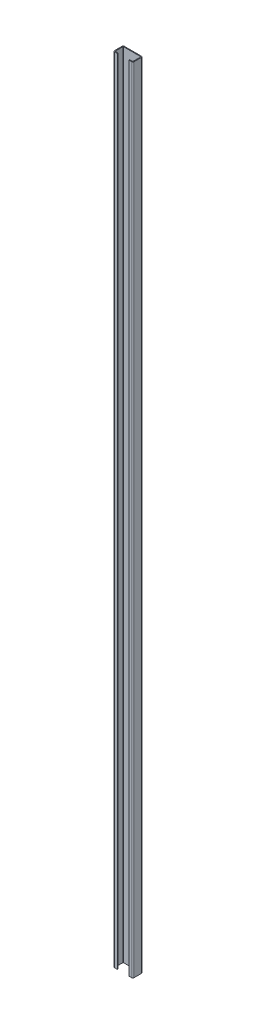
from build123d import *

# Parameters (mm, degrees)
BASEFLANGE_W                   = 50
BASEFLANGE_H                   = 2050
BASE_FLANGE1_DEPTH             = 2
EDGE_FLANGE1_STRIP_W           = 10
EDGE_FLANGE1_STRIP_H           = 2
EDGE_FLANGE1_STRIP_CUT_DEPTH   = 2050
EDGE_FLANGE1_STRIP_2_W         = 10
EDGE_FLANGE1_STRIP_2_H         = 2
EDGE_FLANGE1_STRIP_CUT_2_DEPTH = 2050
EDGE_FLANGE1_DEPTH             = 2050
EDGE_FLANGE1_BEND_DEPTH        = 2050
EDGE_FLANGE2_STRIP_W           = 10
EDGE_FLANGE2_STRIP_H           = 2
EDGE_FLANGE2_STRIP_CUT_DEPTH   = 2050
EDGE_FLANGE2_STRIP_2_W         = 10
EDGE_FLANGE2_STRIP_2_H         = 2
EDGE_FLANGE2_STRIP_CUT_2_DEPTH = 2050
EDGE_FLANGE2_DEPTH             = 2050
EDGE_FLANGE2_BEND_DEPTH        = 2050
SKETCH18_R                     = 1.6
CUT_EXTRUDE1_DEPTH             = 1026.609574838


# Sheet-metal steps are written as plain solids
with BuildPart() as part:
    # BaseFlange → Base-Flange1 (new body)
    with BuildSketch(Plane.XY):
        Rectangle(BASEFLANGE_W, BASEFLANGE_H)
    extrude(amount=BASE_FLANGE1_DEPTH)

    # Edge-Flange1 strip (across the edge) → Edge-Flange1 strip cut (cut)
    with BuildSketch(Plane(origin=(25, -1025, 2), x_dir=(-1, 0, 0), z_dir=(0, 1, 0))):
        with Locations((-2, -1)):
            Rectangle(EDGE_FLANGE1_STRIP_W, EDGE_FLANGE1_STRIP_H)
    extrude(amount=EDGE_FLANGE1_STRIP_CUT_DEPTH, mode=Mode.SUBTRACT)

    # Edge-Flange1 strip 2 (across the edge) → Edge-Flange1 strip cut 2 (cut)
    with BuildSketch(Plane(origin=(-25, 1025, 2), x_dir=(1, 0, 0), z_dir=(0, -1, 0))):
        with Locations((-2, -1)):
            Rectangle(EDGE_FLANGE1_STRIP_2_W, EDGE_FLANGE1_STRIP_2_H)
    extrude(amount=EDGE_FLANGE1_STRIP_CUT_2_DEPTH, mode=Mode.SUBTRACT)

    # Edge-Flange1 section (across the edge) → Edge-Flange1 (add)
    with BuildSketch(Plane(origin=(25, -1025, 2), x_dir=(-1, 0, 0), z_dir=(0, 1, 0))):
        with BuildLine():
            Line((0, 1), (0, 23))
            Line((0, 23), (2, 23))
            Line((2, 23), (2, 1))
            ThreePointArc((2, 1), (2.292893219, 0.292893219), (3, 0))
            Line((3, 0), (3, -2))
            ThreePointArc((3, -2), (0.878679656, -1.121320344), (0, 1))
        make_face()
    extrude(amount=EDGE_FLANGE1_DEPTH)

    # Edge-Flange1 section 2 (across the edge) → Edge-Flange1 bend (add)
    with BuildSketch(Plane(origin=(-25, 1025, 2), x_dir=(1, 0, 0), z_dir=(0, -1, 0))):
        with BuildLine():
            Line((0, 1), (0, 23))
            Line((0, 23), (2, 23))
            Line((2, 23), (2, 1))
            ThreePointArc((2, 1), (2.292893219, 0.292893219), (3, 0))
            Line((3, 0), (3, -2))
            ThreePointArc((3, -2), (0.878679656, -1.121320344), (0, 1))
        make_face()
    extrude(amount=EDGE_FLANGE1_BEND_DEPTH)

    # Edge-Flange2 strip (across the edge) → Edge-Flange2 strip cut (cut)
    with BuildSketch(Plane(origin=(-23, 1025, 25), x_dir=(0, 0, -1), z_dir=(0, -1, 0))):
        with Locations((-2, -1)):
            Rectangle(EDGE_FLANGE2_STRIP_W, EDGE_FLANGE2_STRIP_H)
    extrude(amount=EDGE_FLANGE2_STRIP_CUT_DEPTH, mode=Mode.SUBTRACT)

    # Edge-Flange2 strip 2 (across the edge) → Edge-Flange2 strip cut 2 (cut)
    with BuildSketch(Plane(origin=(23, -1025, 25), x_dir=(0, 0, -1), z_dir=(0, 1, 0))):
        with Locations((-2, -1)):
            Rectangle(EDGE_FLANGE2_STRIP_2_W, EDGE_FLANGE2_STRIP_2_H)
    extrude(amount=EDGE_FLANGE2_STRIP_CUT_2_DEPTH, mode=Mode.SUBTRACT)

    # Edge-Flange2 section (across the edge) → Edge-Flange2 (add)
    with BuildSketch(Plane(origin=(-23, 1025, 25), x_dir=(0, 0, -1), z_dir=(0, -1, 0))):
        with BuildLine():
            Line((0, 1), (0, 8))
            Line((0, 8), (2, 8))
            Line((2, 8), (2, 1))
            ThreePointArc((2, 1), (2.292893219, 0.292893219), (3, 0))
            Line((3, 0), (3, -2))
            ThreePointArc((3, -2), (0.878679656, -1.121320344), (0, 1))
        make_face()
    extrude(amount=EDGE_FLANGE2_DEPTH)

    # Edge-Flange2 section 2 (across the edge) → Edge-Flange2 bend (add)
    with BuildSketch(Plane(origin=(23, -1025, 25), x_dir=(0, 0, -1), z_dir=(0, 1, 0))):
        with BuildLine():
            Line((0, 1), (0, 8))
            Line((0, 8), (2, 8))
            Line((2, 8), (2, 1))
            ThreePointArc((2, 1), (2.292893219, 0.292893219), (3, 0))
            Line((3, 0), (3, -2))
            ThreePointArc((3, -2), (0.878679656, -1.121320344), (0, 1))
        make_face()
    extrude(amount=EDGE_FLANGE2_BEND_DEPTH)

    # Sketch18 → Cut-Extrude1 (cut, through all)
    with BuildSketch(Plane.XY):
        with Locations(Location((0, -17.5, 0), (0, 0, 180))):
            Circle(SKETCH18_R)
        with Locations(Location((0, -942.5, 0), (0, 0, 180))):
            Circle(SKETCH18_R)
        with Locations(Location((0, 942.5, 0), (0, 0, 180))):
            Circle(SKETCH18_R)
        with Locations(Location((0, -907.5, 0), (0, 0, 180))):
            Circle(SKETCH18_R)
        with Locations(Location((0, 17.5, 0), (0, 0, 180))):
            Circle(SKETCH18_R)
        with Locations(Location((0, 907.5, 0), (0, 0, 180))):
            Circle(SKETCH18_R)
    extrude(amount=CUT_EXTRUDE1_DEPTH, mode=Mode.SUBTRACT)


solid = part.part
